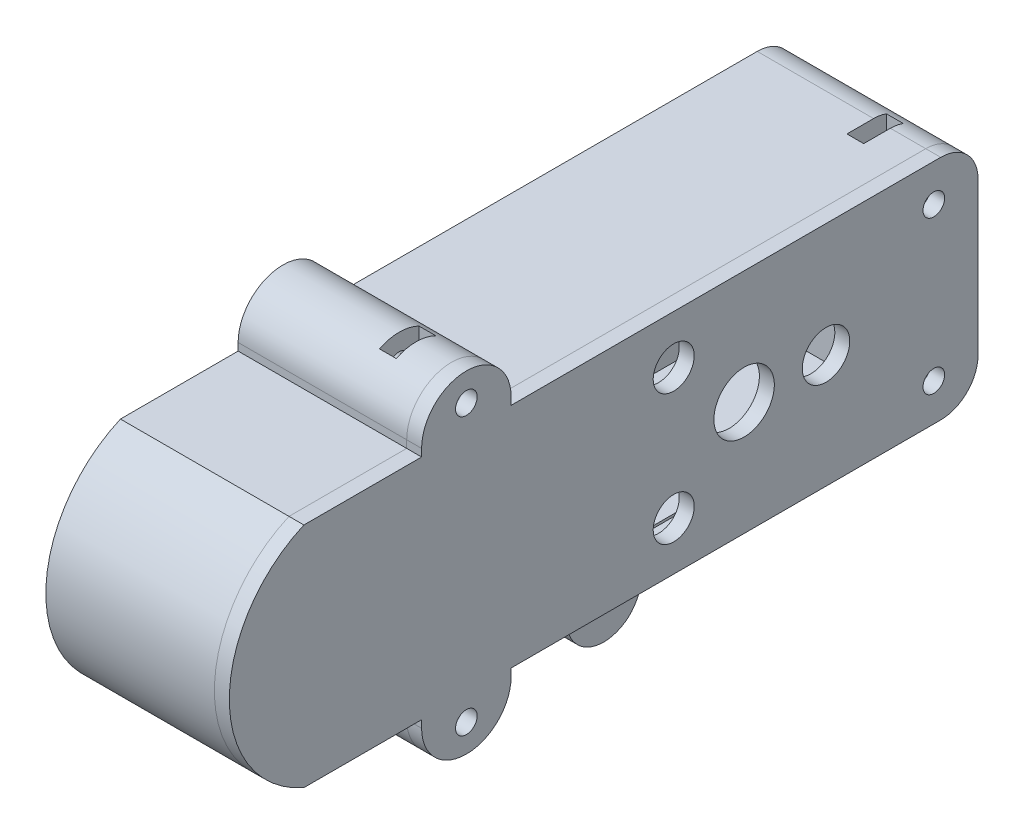
from build123d import *

# Parameters (mm, degrees)
BOSS_EXTRUDE1_DEPTH             = 3
FILLET1_R                       = 5
BOSS_EXTRUDE2_DEPTH             = 19.6
BOSS_EXTRUDE5_DEPTH             = 18.6
SKETCH5_W                       = 7
SKETCH5_H                       = 7
CUT_EXTRUDE1_DEPTH              = 11.8
SKETCH6_W                       = 3.6
SKETCH6_H                       = 31.86
CUT_EXTRUDE2_DEPTH              = 84.765879092
BOSS_EXTRUDE6_DEPTH             = 22.6
BOSS_EXTRUDE7_DEPTH             = 2
BOSS_EXTRUDE8_DEPTH             = 5
CUT_EXTRUDE4_DEPTH              = 3
CUT_EXTRUDE5_DEPTH              = 87.773397421
CUT_EXTRUDE5_DEPTH_BACK         = 2
SKETCH12_W                      = 33.35
SKETCH12_H                      = 24.5
SKETCH13_R                      = 3.18
SKETCH13_R_2                    = 4.05
SKETCH13_R_3                    = 2.75
SKETCH13_W                      = 6.5
SKETCH13_H                      = 9.15
CUT_EXTRUDE6_DEPTH              = 88.027711104
SKETCH14_W                      = 6.5
SKETCH14_H                      = 9.15
BOSS_EXTRUDE9_DEPTH             = 1.17
BOSS_EXTRUDE10_DEPTH            = 18.6
SKETCH19_W                      = 1.8
SKETCH19_H                      = 17.3
CUT_EXTRUDE9_DEPTH              = 0.381
SKETCH24_W                      = 1.45
SKETCH24_H                      = 22.6
M2_5_CLEARANCE_HOLE1_AT_2_COUNT = 2
M2_5_CLEARANCE_HOLE1_AT_2_PITCH = 17.5
CUT_EXTRUDE11_DEPTH             = 1.5
CUT_SWEEP1_START                = 17.6
CUT_SWEEP1_DEPTH                = 2
SWEEP1_START                    = 17.85
SWEEP1_DEPTH                    = 1.75
M2_5_CLEARANCE_HOLE2_AT_2_COUNT = 2
M2_5_CLEARANCE_HOLE2_AT_2_PITCH = 20.5
M2_5_CLEARANCE_HOLE2_AT_3_COUNT = 2
M2_5_CLEARANCE_HOLE2_AT_3_PITCH = 63.218255813
M2_5_CLEARANCE_HOLE2_AT_4_COUNT = 2
M2_5_CLEARANCE_HOLE2_AT_4_PITCH = 68.965030037
CUT_EXTRUDE12_DEPTH             = 2.25


# Read off the part's stored shape, not the designer's step: Cut-Sweep1, Sweep1
with BuildPart() as part:
    # Sketch1 → Boss-Extrude1 (new body)
    with BuildSketch(Plane(origin=(0, 0, 0), x_dir=(0, 0, -1), z_dir=(1, 0, 0))):
        with BuildLine():
            Line((20.38, -15.25), (-70, -15.25))
            ThreePointArc((-70, -15.25), (-80, 0), (-70, 15.25))
            Line((-70, 15.25), (20.38, 15.25))
            Line((20.38, 15.25), (20.38, -15.25))
        make_face()
    extrude(amount=-BOSS_EXTRUDE1_DEPTH)

    # Fillet1
    fillet1_edges = [part.edges().sort_by_distance(p)[0] for p in [
        (-1.5, -15.25, -20.38),
        (-1.5, 15.25, -20.38),
    ]]
    fillet(fillet1_edges, radius=FILLET1_R)

    # Sketch2 → Boss-Extrude2 (add)
    with BuildSketch(Plane(origin=(0, 0, 0), x_dir=(0, 0, -1), z_dir=(1, 0, 0))):
        with BuildLine():
            Line((-70, -15.25), (15.38, -15.25))
            ThreePointArc((15.38, -15.25), (18.915533906, -13.785533906), (20.38, -10.25))
            Line((20.38, -10.25), (20.38, 10.25))
            ThreePointArc((20.38, 10.25), (18.915533906, 13.785533906), (15.38, 15.25))
            Line((15.38, 15.25), (-70, 15.25))
            ThreePointArc((-70, 15.25), (-80, 0), (-70, -15.25))
        make_face()
        with BuildLine():
            Line((-69.34375, -12.25), (15.38, -12.25))
            ThreePointArc((15.38, -12.25), (16.794213562, -11.664213562), (17.38, -10.25))
            Line((17.38, -10.25), (17.38, 10.25))
            ThreePointArc((17.38, 10.25), (16.794213562, 11.664213562), (15.38, 12.25))
            Line((15.38, 12.25), (-69.34375, 12.25))
            ThreePointArc((-69.34375, 12.25), (-77, 0), (-69.34375, -12.25))
        make_face(mode=Mode.SUBTRACT)
    extrude(amount=BOSS_EXTRUDE2_DEPTH)

    # Sketch3 → Boss-Extrude5 (add)
    with BuildSketch(Plane(origin=(0, 0, 0), x_dir=(0, 0, -1), z_dir=(1, 0, 0))):
        with BuildLine():
            Line((-34.62, 12.25), (-34.62, 11.25))
            Line((-34.62, 11.25), (10.38, 11.25))
            ThreePointArc((10.38, 11.25), (11.087106781, 10.957106781), (11.38, 10.25))
            Line((11.38, 10.25), (11.38, -12.25))
            Line((11.38, -12.25), (15.38, -12.25))
            ThreePointArc((15.38, -12.25), (16.794213562, -11.664213562), (17.38, -10.25))
            Line((17.38, -10.25), (17.38, 10.25))
            ThreePointArc((17.38, 10.25), (16.794213562, 11.664213562), (15.38, 12.25))
            Line((15.38, 12.25), (-34.62, 12.25))
        make_face()
    extrude(amount=BOSS_EXTRUDE5_DEPTH)

    # Sketch5 → Cut-Extrude1 (cut)
    with BuildSketch(Plane(origin=(18.6, 0, 0), x_dir=(0, 0, -1), z_dir=(1, 0, 0))):
        with Locations((13.88, 0)):
            Rectangle(SKETCH5_W, SKETCH5_H)
    extrude(amount=-CUT_EXTRUDE1_DEPTH, mode=Mode.SUBTRACT)

    # Sketch6 → Cut-Extrude2 (cut, through all)
    with BuildSketch(Plane(origin=(0, 0, 0), x_dir=(0, 0, -1), z_dir=(1, 0, 0))):
        with Locations((-48.219004673, -0.125)):
            Rectangle(SKETCH6_W, SKETCH6_H)
    extrude(amount=CUT_EXTRUDE2_DEPTH, mode=Mode.SUBTRACT)

    # Sketch7 → Boss-Extrude6 (add)
    with BuildSketch(Plane.ZY.offset(3)):
        with BuildLine():
            Line((54.219004673, 16.25), (54.219004673, 15.25))
            Line((54.219004673, 15.25), (42.219004673, 15.25))
            Line((42.219004673, 15.25), (42.219004673, 16.25))
            ThreePointArc((42.219004673, 16.25), (48.219004673, 22.25), (54.219004673, 16.25))
        make_face()
        with BuildLine():
            Line((42.219004673, -16.25), (42.219004673, -15.25))
            Line((42.219004673, -15.25), (54.219004673, -15.25))
            Line((54.219004673, -15.25), (54.219004673, -16.25))
            ThreePointArc((54.219004673, -16.25), (48.219004673, -22.25), (42.219004673, -16.25))
        make_face()
    extrude(amount=-BOSS_EXTRUDE6_DEPTH)

    # Sketch9 → Boss-Extrude8 (add, symmetric)
    with BuildSketch(Plane(origin=(9.3, 0, 0), x_dir=(0, 0, -1), z_dir=(1, 0, 0))):
        with BuildLine():
            Line((-27.5, -15.25), (-27.5, -20.75))
            ThreePointArc((-27.5, -20.75), (-22.5, -25.75), (-17.5, -20.75))
            Line((-17.5, -20.75), (-17.5, -15.25))
            Line((-17.5, -15.25), (-27.5, -15.25))
        make_face()
    extrude(amount=BOSS_EXTRUDE8_DEPTH, both=True)

    # Sketch11 → Cut-Extrude4 (cut)
    with BuildSketch(Plane.ZY.offset(3)):
        Polygon((56.019004673, -5.125), (53.064735616, -5.125), (50.019004673, -5.125), (50.019004673, -11.125), (46.419004673, -11.125), (46.419004673, -7.125), (44.204136306, -7.125), (40.419004673, -7.125), (40.419004673, 6.875), (44.204136306, 6.875), (46.419004673, 6.875), (46.419004673, 10.875), (50.019004673, 10.875), (50.019004673, 4.875), (53.064735616, 4.875), (56.019004673, 4.875), align=None)
    extrude(amount=-CUT_EXTRUDE4_DEPTH, mode=Mode.SUBTRACT)

    # Sketch12 → Cut-Extrude5 (cut, two sides: drawn at the far end of the back side and taken through both)
    with BuildSketch(Plane(origin=(0, 0, 0), x_dir=(0, 0, -1), z_dir=(1, 0, 0)).offset(-CUT_EXTRUDE5_DEPTH_BACK)):
        with Locations((-42.295, 0)):
            Rectangle(SKETCH12_W, SKETCH12_H)
    extrude(amount=CUT_EXTRUDE5_DEPTH + CUT_EXTRUDE5_DEPTH_BACK, mode=Mode.SUBTRACT)

    # Sketch15 → Boss-Extrude10 (add)
    with BuildSketch(Plane(origin=(0, 0, 0), x_dir=(0, 0, -1), z_dir=(1, 0, 0))):
        with BuildLine():
            Line((-69.34375, 12.25), (-58.97, 12.25))
            Line((-58.97, 12.25), (-58.97, -12.25))
            Line((-58.97, -12.25), (-69.34375, -12.25))
            ThreePointArc((-69.34375, -12.25), (-77, 0), (-69.34375, 12.25))
        make_face()
    extrude(amount=BOSS_EXTRUDE10_DEPTH)

    # Sketch19 → M3 Clearance Hole1 (revolve, cut)
    with BuildSketch(Plane(origin=(14.3, -20.75, 22.5), x_dir=(0, 0, -1), z_dir=(0, 1, 0))):
        with Locations((0.9, 8.65)):
            Rectangle(SKETCH19_W, SKETCH19_H)
    revolve(axis=Axis((20.65, -20.75, 22.5), (-1, 0, 0)), mode=Mode.SUBTRACT)

    # Sketch20 → Cut-Extrude9 (cut, symmetric)
    with BuildSketch(Plane(origin=(9.3, 0, 0), x_dir=(0, 0, -1), z_dir=(1, 0, 0))):
        with BuildLine():
            Line((-27.5, -15.25), (-27.5, -20.75))
            ThreePointArc((-27.5, -20.75), (-22.5, -25.75), (-17.5, -20.75))
            Line((-17.5, -20.75), (-17.5, -15.25))
            Line((-17.5, -15.25), (-27.5, -15.25))
        make_face()
    extrude(amount=CUT_EXTRUDE9_DEPTH, both=True, mode=Mode.SUBTRACT)

    # Sketch24 → M2.5 Clearance Hole1 (revolve, cut)
    with BuildSketch(Plane(origin=(19.6, 8.75, 20.42), x_dir=(0, 0, -1), z_dir=(0, 1, 0))):
        with Locations((0.725, 11.3)):
            Rectangle(SKETCH24_W, SKETCH24_H)
    m2_5_clearance_hole1 = revolve(axis=Axis((25.95, 8.75, 20.42), (-1, 0, 0)), mode=Mode.SUBTRACT)

    # M2.5 Clearance Hole1 at 2: M2.5 Clearance Hole1 ×2
    with Locations(*[(0, -i * M2_5_CLEARANCE_HOLE1_AT_2_PITCH, 0) for i in range(1, M2_5_CLEARANCE_HOLE1_AT_2_COUNT)]):
        add(m2_5_clearance_hole1, mode=Mode.SUBTRACT)

    # Sketch25 → Cut-Extrude11 (cut)
    with BuildSketch(Plane.ZY.offset(3)):
        Polygon((21.949978213, 11.4), (18.890021787, 11.4), (17.360043573, 8.75), (18.890021787, 6.1), (21.949978213, 6.1), (23.479956427, 8.75), align=None)
        Polygon((21.949978213, -6.1), (18.890021787, -6.1), (17.360043573, -8.75), (18.890021787, -11.4), (21.949978213, -11.4), (23.479956427, -8.75), align=None)
    extrude(amount=-CUT_EXTRUDE11_DEPTH, mode=Mode.SUBTRACT)

    # Cut-Sweep1 outline → Cut-Sweep1 (cut)
    with BuildSketch(Plane.YZ.offset(CUT_SWEEP1_START)):
        with BuildLine():
            Line((13.75, 50.019004673), (13.750000543, 69.689903972))
            add(Edge.make_bspline(
                [(13.750000543, 69.689903972), (13.699882298, 69.792712373), (13.651878267, 69.891184581), (13.451556981, 70.302079903), (13.278489472, 70.629003991), (12.926387976, 71.239066223), (12.739704388, 71.537908275), (12.149072795, 72.413788602), (11.71448551, 72.970152108), (10.300980797, 74.540298052), (9.212233376, 75.454034867), (5.62920389, 77.693428295), (2.816852829, 78.5), (-2.816852829, 78.5), (-5.62920389, 77.693428295), (-9.212233376, 75.454034867), (-10.300980797, 74.540298052), (-11.71448551, 72.970152108), (-12.149072795, 72.413788602), (-12.739704388, 71.537908275), (-12.926387976, 71.239066223), (-13.278489472, 70.629003991), (-13.451556981, 70.302079903), (-13.651878267, 69.891184581), (-13.699882298, 69.792712373), (-13.750000543, 69.689903972)],
                knots=[-0.011405638, -0.011405638, -0.011405638, -0.011405638, 0, 0, 0.03125, 0.03125, 0.0625, 0.0625, 0.125, 0.125, 0.25, 0.25, 0.5, 0.5, 0.75, 0.75, 0.875, 0.875, 0.9375, 0.9375, 0.96875, 0.96875, 1, 1, 1.011405638, 1.011405638, 1.011405638, 1.011405638], degree=3))
            Line((-13.750000543, 69.689903972), (-13.75, 50.019004673))
            Line((-13.75, 50.019004673), (-12.25, 50.019004673))
            Line((-12.25, 50.019004673), (-12.25, 69.34375))
            ThreePointArc((-12.25, 69.34375), (0, 77), (12.25, 69.34375))
            Line((12.25, 69.34375), (12.25, 50.019004673))
            Line((12.25, 50.019004673), (13.75, 50.019004673))
        make_face()
        with BuildLine():
            Line((13.75, 46.419004673), (12.25, 46.419004673))
            Line((12.25, 46.419004673), (12.25, -15.38))
            ThreePointArc((12.25, -15.38), (11.664213562, -16.794213562), (10.25, -17.38))
            Line((10.25, -17.38), (-10.25, -17.38))
            ThreePointArc((-10.25, -17.38), (-11.664213562, -16.794213562), (-12.25, -15.38))
            Line((-12.25, -15.38), (-12.25, 46.419004673))
            Line((-12.25, 46.419004673), (-13.75, 46.419004673))
            Line((-13.75, 46.419004673), (-13.75, -15.38))
            ThreePointArc((-13.75, -15.38), (-12.724873734, -17.854873734), (-10.25, -18.88))
            Line((-10.25, -18.88), (10.25, -18.88))
            ThreePointArc((10.25, -18.88), (12.724873734, -17.854873734), (13.75, -15.38))
            Line((13.75, -15.38), (13.75, 46.419004673))
        make_face()
    extrude(amount=CUT_SWEEP1_DEPTH, mode=Mode.SUBTRACT)


with BuildPart() as body_2:
    # Sketch8 → Boss-Extrude7 (new body)
    with BuildSketch(Plane(origin=(19.6, 0, 0), x_dir=(0, 0, -1), z_dir=(1, 0, 0))):
        with BuildLine():
            Line((-70, -15.25), (-54.219004673, -15.25))
            Line((-54.219004673, -15.25), (-54.219004673, -16.25))
            ThreePointArc((-54.219004673, -16.25), (-48.219004673, -22.25), (-42.219004673, -16.25))
            Line((-42.219004673, -16.25), (-42.219004673, -15.25))
            Line((-42.219004673, -15.25), (15.38, -15.25))
            ThreePointArc((15.38, -15.25), (18.915533906, -13.785533906), (20.38, -10.25))
            Line((20.38, -10.25), (20.38, 10.25))
            ThreePointArc((20.38, 10.25), (18.915533906, 13.785533906), (15.38, 15.25))
            Line((15.38, 15.25), (-42.219004673, 15.25))
            Line((-42.219004673, 15.25), (-42.219004673, 16.25))
            ThreePointArc((-42.219004673, 16.25), (-48.219004673, 22.25), (-54.219004673, 16.25))
            Line((-54.219004673, 16.25), (-54.219004673, 15.25))
            Line((-54.219004673, 15.25), (-70, 15.25))
            ThreePointArc((-70, 15.25), (-80, 0), (-70, -15.25))
        make_face()
    extrude(amount=BOSS_EXTRUDE7_DEPTH)

    # Sketch13 → Cut-Extrude6 (cut, through all)
    with BuildSketch(Plane.ZY.offset(-19.6)):
        Circle(SKETCH13_R)
        with Locations((10.979551962, 0)):
            Circle(SKETCH13_R_2)
        with Locations((20.42, -8.75)):
            Circle(SKETCH13_R_3)
        with Locations((20.42, 8.75)):
            Circle(SKETCH13_R_3)
        with Locations((31.37, 0)):
            Rectangle(SKETCH13_W, SKETCH13_H)
    extrude(amount=-CUT_EXTRUDE6_DEPTH, mode=Mode.SUBTRACT)

    # Sketch14 → Boss-Extrude9 (add)
    with BuildSketch(Plane(origin=(21.6, 0, 0), x_dir=(0, 0, -1), z_dir=(1, 0, 0))):
        with Locations((-31.37, 0)):
            Rectangle(SKETCH14_W, SKETCH14_H)
    extrude(amount=-BOSS_EXTRUDE9_DEPTH)

    # Sweep1 outline → Sweep1 (add)
    with BuildSketch(Plane.YZ.offset(SWEEP1_START)):
        with BuildLine():
            Line((13.675, -15.38), (13.675000544, 69.672596279))
            add(Edge.make_bspline(
                [(13.675000544, 69.672596279), (13.627413375, 69.770212645), (13.581636307, 69.86411651), (13.384524027, 70.268429625), (13.212659324, 70.593025661), (12.862303425, 71.200063416), (12.67654535, 71.497423913), (12.088841903, 72.368961929), (11.656409152, 72.922567177), (10.249912104, 74.484928882), (9.166562316, 75.394135706), (5.601296248, 77.622426998), (2.802887849, 78.425), (-2.802887849, 78.425), (-5.601296249, 77.622426998), (-9.166562316, 75.394135706), (-10.249912104, 74.484928882), (-11.656409152, 72.922567177), (-12.088841903, 72.368961929), (-12.67654535, 71.497423913), (-12.862303425, 71.200063416), (-13.212659324, 70.593025661), (-13.384524027, 70.268429625), (-13.581636307, 69.86411651), (-13.627413375, 69.770212645), (-13.675000544, 69.672596279)],
                knots=[-0.010832084, -0.010832084, -0.010832084, -0.010832084, 0, 0, 0.03125, 0.03125, 0.0625, 0.0625, 0.125, 0.125, 0.25, 0.25, 0.5, 0.5, 0.75, 0.75, 0.875, 0.875, 0.9375, 0.9375, 0.96875, 0.96875, 1, 1, 1.010832084, 1.010832084, 1.010832084, 1.010832084], degree=3))
            Line((-13.675000544, 69.672596279), (-13.675, -15.38))
            ThreePointArc((-13.675, -15.38), (-12.671840726, -17.801840726), (-10.25, -18.805))
            Line((-10.25, -18.805), (10.25, -18.805))
            ThreePointArc((10.25, -18.805), (12.671840726, -17.801840726), (13.675, -15.38))
        make_face()
        with BuildLine():
            add(Edge.make_bspline(
                [(12.325000295, 69.36105776), (12.322472794, 69.366242172), (12.319944622, 69.37142794), (12.177930855, 69.662724627), (12.027716657, 69.94541572), (11.708781507, 70.498012888), (11.539682657, 70.768705388), (11.004685851, 71.562081805), (10.611034696, 72.066038421), (9.330675644, 73.488283817), (8.344483238, 74.315950814), (5.098958698, 76.344403651), (2.55151821, 77.075), (-2.55151821, 77.075), (-5.098958698, 76.344403651), (-8.344483238, 74.315950814), (-9.330675644, 73.488283817), (-10.611034696, 72.066038421), (-11.004685851, 71.562081805), (-11.539682657, 70.768705388), (-11.708781507, 70.498012888), (-12.027716657, 69.94541572), (-12.177930855, 69.662724627), (-12.319944622, 69.37142794), (-12.322472794, 69.366242172), (-12.325000295, 69.36105776)],
                knots=[-0.00056657, -0.00056657, -0.00056657, -0.00056657, 0, 0, 0.03125, 0.03125, 0.0625, 0.0625, 0.125, 0.125, 0.25, 0.25, 0.5, 0.5, 0.75, 0.75, 0.875, 0.875, 0.9375, 0.9375, 0.96875, 0.96875, 1, 1, 1.00056657, 1.00056657, 1.00056657, 1.00056657], degree=3))
            Line((12.325000295, 69.36105776), (12.325, -15.38))
            ThreePointArc((12.325, -15.38), (11.717246571, -16.847246571), (10.25, -17.455))
            Line((10.25, -17.455), (-10.25, -17.455))
            ThreePointArc((-10.25, -17.455), (-11.717246571, -16.847246571), (-12.325, -15.38))
            Line((-12.325, -15.38), (-12.325000295, 69.36105776))
        make_face(mode=Mode.SUBTRACT)
    extrude(amount=SWEEP1_DEPTH)


with BuildPart() as m2_5_clearance_hole2_tool:
    # Sketch30 → M2.5 Clearance Hole2 (revolve)
    with BuildSketch(Plane(origin=(21.6, 10.25, -14.455), x_dir=(0, 0, -1), z_dir=(0, 1, 0))):
        Polygon((0, 0), (0, 15.871247898), (1.45, 15), (1.45, 0), align=None)
    m2_5_clearance_hole2 = revolve(axis=Axis((27.95, 10.25, -14.455), (-1, 0, 0)))


with BuildPart() as part_1:
    add(part.part)

    # M2.5 Clearance Hole2: cut by m2_5_clearance_hole2_tool
    add(m2_5_clearance_hole2_tool.part, mode=Mode.SUBTRACT)


with BuildPart() as body_2_1:
    add(body_2.part)

    # M2.5 Clearance Hole2: cut by m2_5_clearance_hole2_tool
    add(m2_5_clearance_hole2_tool.part, mode=Mode.SUBTRACT)


with BuildPart() as m2_5_clearance_hole2_at_2_tool:
    # M2.5 Clearance Hole2 at 2: M2.5 Clearance Hole2 ×2
    with Locations(*[(0, -i * M2_5_CLEARANCE_HOLE2_AT_2_PITCH, 0) for i in range(1, M2_5_CLEARANCE_HOLE2_AT_2_COUNT)]):
        add(m2_5_clearance_hole2)


with BuildPart() as part_2:
    add(part_1.part)

    # M2.5 Clearance Hole2 at 2: cut by m2_5_clearance_hole2_at_2_tool
    add(m2_5_clearance_hole2_at_2_tool.part, mode=Mode.SUBTRACT)


with BuildPart() as body_2_2:
    add(body_2_1.part)

    # M2.5 Clearance Hole2 at 2: cut by m2_5_clearance_hole2_at_2_tool
    add(m2_5_clearance_hole2_at_2_tool.part, mode=Mode.SUBTRACT)


with BuildPart() as m2_5_clearance_hole2_at_3_tool:
    # M2.5 Clearance Hole2 at 3: M2.5 Clearance Hole2 ×2
    with Locations(*[Vector(0, 0.13093527958967807, 0.9913909181340995) * (i * M2_5_CLEARANCE_HOLE2_AT_3_PITCH) for i in range(1, M2_5_CLEARANCE_HOLE2_AT_3_COUNT)]):
        add(m2_5_clearance_hole2)


with BuildPart() as part_3:
    add(part_2.part)

    # M2.5 Clearance Hole2 at 3: cut by m2_5_clearance_hole2_at_3_tool
    add(m2_5_clearance_hole2_at_3_tool.part, mode=Mode.SUBTRACT)


with BuildPart() as body_2_3:
    add(body_2_2.part)

    # M2.5 Clearance Hole2 at 3: cut by m2_5_clearance_hole2_at_3_tool
    add(m2_5_clearance_hole2_at_3_tool.part, mode=Mode.SUBTRACT)


with BuildPart() as m2_5_clearance_hole2_at_4_tool:
    # M2.5 Clearance Hole2 at 4: M2.5 Clearance Hole2 ×2
    with Locations(*[Vector(0, -0.4172766978365117, 0.9087794877981438) * (i * M2_5_CLEARANCE_HOLE2_AT_4_PITCH) for i in range(1, M2_5_CLEARANCE_HOLE2_AT_4_COUNT)]):
        add(m2_5_clearance_hole2)


with BuildPart() as part_4:
    add(part_3.part)

    # M2.5 Clearance Hole2 at 4: cut by m2_5_clearance_hole2_at_4_tool
    add(m2_5_clearance_hole2_at_4_tool.part, mode=Mode.SUBTRACT)

    # Sketch31 → Cut-Extrude12 (cut)
    with BuildSketch(Plane(origin=(12.6, 0, 0), x_dir=(0, 0, -1), z_dir=(1, 0, 0))):
        Polygon((-50.869004673, 20.057478213), (-50.869004673, 16.997521787), (-48.219004673, 15.467543573), (-45.569004673, 16.997521787), (-45.569004673, 20.057478213), (-45.569004673, 22.25), (-50.869004673, 22.25), align=None)
        Polygon((-45.569004673, -22.25), (-45.569004673, -20.057478213), (-45.569004673, -16.997521787), (-48.219004673, -15.467543573), (-50.869004673, -16.997521787), (-50.869004673, -20.057478213), (-50.869004673, -22.25), align=None)
        Polygon((11.805, 11.779978213), (11.805, 15.25), (17.105, 15.25), (17.105, 11.779978213), (17.105, 8.720021787), (14.455, 7.190043573), (11.805, 8.720021787), align=None)
        Polygon((17.105, -15.25), (17.105, -11.779978213), (17.105, -8.720021787), (14.455, -7.190043573), (11.805, -8.720021787), (11.805, -11.779978213), (11.805, -15.25), align=None)
    extrude(amount=CUT_EXTRUDE12_DEPTH, mode=Mode.SUBTRACT)


with BuildPart() as body_2_4:
    add(body_2_3.part)

    # M2.5 Clearance Hole2 at 4: cut by m2_5_clearance_hole2_at_4_tool
    add(m2_5_clearance_hole2_at_4_tool.part, mode=Mode.SUBTRACT)


solid = Compound([part_4.part, body_2_4.part])
